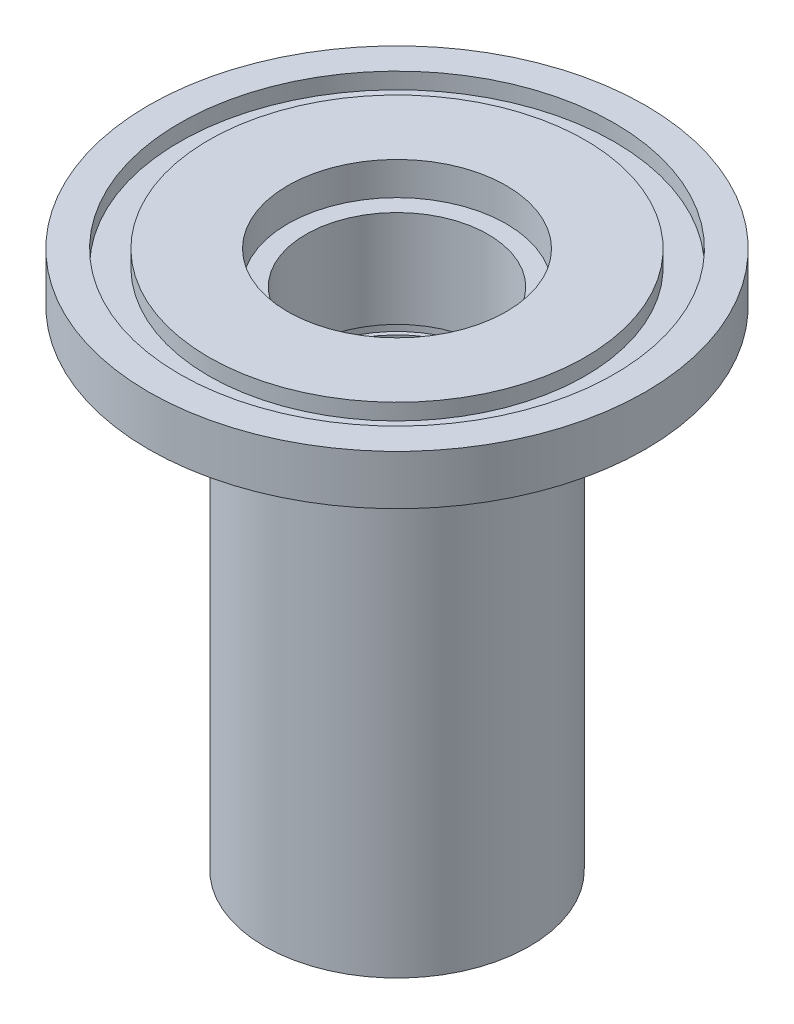
from build123d import *


with BuildPart() as part:
    # Sketch1 → Revolve1 (revolve)
    with BuildSketch(Plane.XY):
        Polygon((30, 0), (26.2636, 0), (26.2636, -1.9558), (22.733, -1.9558), (22.733, 0), (13.2, 0), (13.2, -4), (11, -4), (11, -15.7), (11.5, -15.7), (11.5, -16.8), (11, -16.8), (11, -31.2), (11.5, -31.2), (11.5, -32.3), (11, -32.3), (11, -65), (16, -65), (16, -6), (30, -6), align=None)
    revolve(axis=Axis((0, 0, 0), (0, -1, 0)))


solid = part.part
